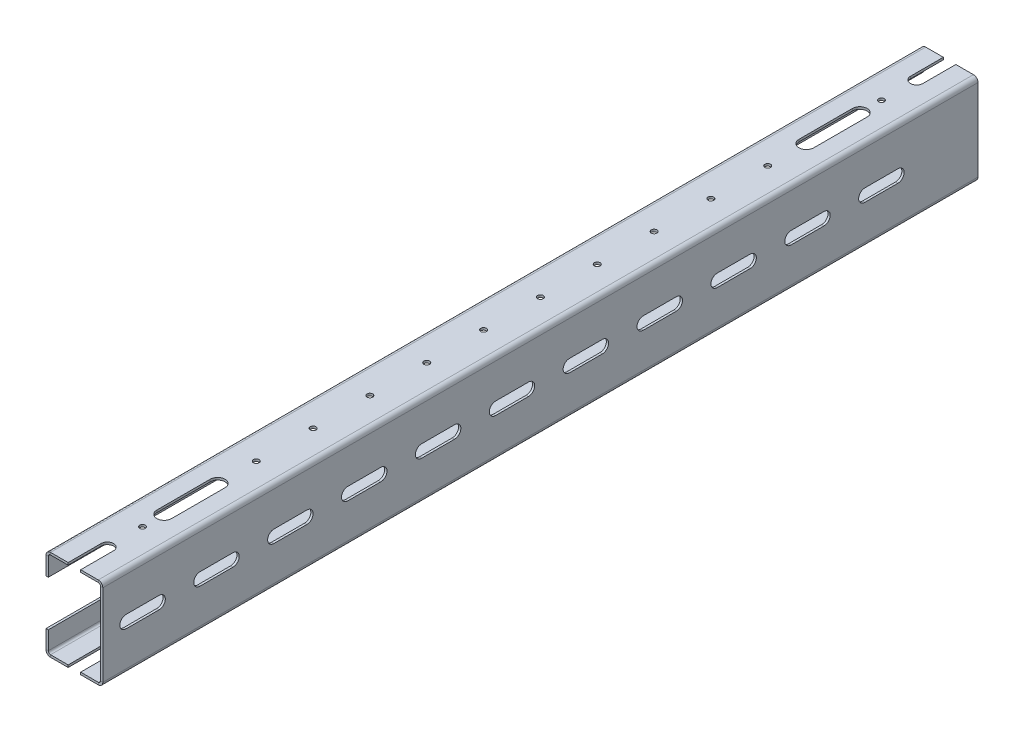
from build123d import *

# Parameters (mm, degrees)
SM_BASE_FLANGE_1_DEPTH = 385
CUT_EXTRUDE_1_DEPTH    = 10
CUT_EXTRUDE_2_DEPTH    = 10
SKETCH_8_R             = 2.5
CUT_EXTRUDE_3_DEPTH    = 10
CUT_EXTRUDE_START      = -10
CUT_EXTRUDE_4_DEPTH    = 10


# Sheet-metal steps are written as plain solids
with BuildPart() as part:
    # Sketch 1 → Базовая кромка1 (new, symmetric)
    with BuildSketch(Plane.XY):
        with BuildLine():
            Line((-50, -20), (-50, -36))
            ThreePointArc((-50, -36), (-48.828427125, -38.828427125), (-46, -40))
            Line((-46, -40), (-4, -40))
            ThreePointArc((-4, -40), (-1.171572875, -38.828427125), (0, -36))
            Line((0, -36), (0, 36))
            ThreePointArc((0, 36), (-1.171572875, 38.828427125), (-4, 40))
            Line((-4, 40), (-46, 40))
            ThreePointArc((-46, 40), (-48.828427125, 38.828427125), (-50, 36))
            Line((-50, 36), (-50, 20))
            Line((-50, 20), (-48, 20))
            Line((-48, 20), (-48, 36))
            ThreePointArc((-48, 36), (-47.414213562, 37.414213562), (-46, 38))
            Line((-46, 38), (-4, 38))
            ThreePointArc((-4, 38), (-2.585786438, 37.414213562), (-2, 36))
            Line((-2, 36), (-2, -36))
            ThreePointArc((-2, -36), (-2.585786438, -37.414213562), (-4, -38))
            Line((-4, -38), (-46, -38))
            ThreePointArc((-46, -38), (-47.414213562, -37.414213562), (-48, -36))
            Line((-48, -36), (-48, -20))
            Line((-48, -20), (-50, -20))
        make_face()
    extrude(amount=SM_BASE_FLANGE_1_DEPTH, both=True)

    # Эскиз6 → Вырез-Вытянуть1 (cut)
    with BuildSketch(Plane(origin=(0, 0, 0), x_dir=(0, 0, -1), z_dir=(1, 0, 0))):
        with BuildLine():
            Line((-364.5, 5.5), (-335.5, 5.5))
            ThreePointArc((-335.5, 5.5), (-330, 0), (-335.5, -5.5))
            Line((-335.5, -5.5), (-364.5, -5.5))
            ThreePointArc((-364.5, -5.5), (-370, 0), (-364.5, 5.5))
        make_face()
        with BuildLine():
            Line((-299.5, 5.5), (-270.5, 5.5))
            ThreePointArc((-270.5, 5.5), (-265, 0), (-270.5, -5.5))
            Line((-270.5, -5.5), (-299.5, -5.5))
            ThreePointArc((-299.5, -5.5), (-305, 0), (-299.5, 5.5))
        make_face()
        with BuildLine():
            Line((-234.5, 5.5), (-205.5, 5.5))
            ThreePointArc((-205.5, 5.5), (-200, 0), (-205.5, -5.5))
            Line((-205.5, -5.5), (-234.5, -5.5))
            ThreePointArc((-234.5, -5.5), (-240, 0), (-234.5, 5.5))
        make_face()
        with BuildLine():
            Line((-169.5, 5.5), (-140.5, 5.5))
            ThreePointArc((-140.5, 5.5), (-135, 0), (-140.5, -5.5))
            Line((-140.5, -5.5), (-169.5, -5.5))
            ThreePointArc((-169.5, -5.5), (-175, 0), (-169.5, 5.5))
        make_face()
        with BuildLine():
            Line((-104.5, 5.5), (-75.5, 5.5))
            ThreePointArc((-75.5, 5.5), (-70, 0), (-75.5, -5.5))
            Line((-75.5, -5.5), (-104.5, -5.5))
            ThreePointArc((-104.5, -5.5), (-110, 0), (-104.5, 5.5))
        make_face()
        with BuildLine():
            Line((-39.5, 5.5), (-10.5, 5.5))
            ThreePointArc((-10.5, 5.5), (-5, 0), (-10.5, -5.5))
            Line((-10.5, -5.5), (-39.5, -5.5))
            ThreePointArc((-39.5, -5.5), (-45, 0), (-39.5, 5.5))
        make_face()
        with BuildLine():
            Line((25.5, 5.5), (54.5, 5.5))
            ThreePointArc((54.5, 5.5), (60, 0), (54.5, -5.5))
            Line((54.5, -5.5), (25.5, -5.5))
            ThreePointArc((25.5, -5.5), (20, 0), (25.5, 5.5))
        make_face()
        with BuildLine():
            Line((90.5, 5.5), (119.5, 5.5))
            ThreePointArc((119.5, 5.5), (125, 0), (119.5, -5.5))
            Line((119.5, -5.5), (90.5, -5.5))
            ThreePointArc((90.5, -5.5), (85, 0), (90.5, 5.5))
        make_face()
        with BuildLine():
            Line((155.5, 5.5), (184.5, 5.5))
            ThreePointArc((184.5, 5.5), (190, 0), (184.5, -5.5))
            Line((184.5, -5.5), (155.5, -5.5))
            ThreePointArc((155.5, -5.5), (150, 0), (155.5, 5.5))
        make_face()
        with BuildLine():
            Line((220.5, 5.5), (249.5, 5.5))
            ThreePointArc((249.5, 5.5), (255, 0), (249.5, -5.5))
            Line((249.5, -5.5), (220.5, -5.5))
            ThreePointArc((220.5, -5.5), (215, 0), (220.5, 5.5))
        make_face()
        with BuildLine():
            Line((285.5, 5.5), (314.5, 5.5))
            ThreePointArc((314.5, 5.5), (320, 0), (314.5, -5.5))
            Line((314.5, -5.5), (285.5, -5.5))
            ThreePointArc((285.5, -5.5), (280, 0), (285.5, 5.5))
        make_face()
    extrude(amount=-CUT_EXTRUDE_1_DEPTH, mode=Mode.SUBTRACT)

    # Эскиз7 → Вырез-Вытянуть2 (cut)
    with BuildSketch(Plane(origin=(0, 40, 0), x_dir=(1, 0, 0), z_dir=(0, 1, 0))):
        with BuildLine():
            Line((-30.5, -385), (-30.5, -356))
            ThreePointArc((-30.5, -356), (-25, -350.5), (-19.5, -356))
            Line((-19.5, -356), (-19.5, -385))
            ThreePointArc((-19.5, -385), (-25, -390.5), (-30.5, -385))
        make_face()
        with BuildLine():
            Line((-31.5, -306), (-31.5, -259))
            ThreePointArc((-31.5, -259), (-25, -252.5), (-18.5, -259))
            Line((-18.5, -259), (-18.5, -306))
            ThreePointArc((-18.5, -306), (-25, -312.5), (-31.5, -306))
        make_face()
        with BuildLine():
            Line((-30.5, 385), (-30.5, 356))
            ThreePointArc((-30.5, 356), (-25, 350.5), (-19.5, 356))
            Line((-19.5, 356), (-19.5, 385))
            ThreePointArc((-19.5, 385), (-25, 390.5), (-30.5, 385))
        make_face()
        with BuildLine():
            Line((-31.5, 306), (-31.5, 259))
            ThreePointArc((-31.5, 259), (-25, 252.5), (-18.5, 259))
            Line((-18.5, 259), (-18.5, 306))
            ThreePointArc((-18.5, 306), (-25, 312.5), (-31.5, 306))
        make_face()
    extrude(amount=-CUT_EXTRUDE_2_DEPTH, mode=Mode.SUBTRACT)

    # Эскиз8 → Вырез-Вытянуть3 (cut)
    with BuildSketch(Plane(origin=(0, 40, 0), x_dir=(1, 0, 0), z_dir=(0, 1, 0))):
        with Locations(Location((-25, -325, 0), (0, 0, 270))):
            Circle(SKETCH_8_R)
        with Locations((-25, -275)):
            Circle(SKETCH_8_R)
        with Locations(Location((-25, -225, 0), (0, 0, 270))):
            Circle(SKETCH_8_R)
        with Locations(Location((-25, -175, 0), (0, 0, 270))):
            Circle(SKETCH_8_R)
        with Locations(Location((-25, -125, 0), (0, 0, 270))):
            Circle(SKETCH_8_R)
        with Locations(Location((-25, -75, 0), (0, 0, 270))):
            Circle(SKETCH_8_R)
        with Locations(Location((-25, -25, 0), (0, 0, 270))):
            Circle(SKETCH_8_R)
        with Locations(Location((-25, 25, 0), (0, 0, 270))):
            Circle(SKETCH_8_R)
        with Locations(Location((-25, 75, 0), (0, 0, 270))):
            Circle(SKETCH_8_R)
        with Locations(Location((-25, 125, 0), (0, 0, 270))):
            Circle(SKETCH_8_R)
        with Locations(Location((-25, 175, 0), (0, 0, 270))):
            Circle(SKETCH_8_R)
        with Locations(Location((-25, 225, 0), (0, 0, 270))):
            Circle(SKETCH_8_R)
        with Locations((-25, 275)):
            Circle(SKETCH_8_R)
        with Locations(Location((-25, 325, 0), (0, 0, 270))):
            Circle(SKETCH_8_R)
    extrude(amount=-CUT_EXTRUDE_3_DEPTH, mode=Mode.SUBTRACT)

    # Эскиз9 → Вырез-Вытянуть4 (cut)
    with BuildSketch(Plane.XZ.offset(40).offset(CUT_EXTRUDE_START)):
        with BuildLine():
            Line((-19.5, 385), (-19.5, 356))
            ThreePointArc((-19.5, 356), (-25, 350.5), (-30.5, 356))
            Line((-30.5, 356), (-30.5, 385))
            ThreePointArc((-30.5, 385), (-25, 390.5), (-19.5, 385))
        make_face()
        with BuildLine():
            Line((-30.5, -385), (-30.5, -356))
            ThreePointArc((-30.5, -356), (-25, -350.5), (-19.5, -356))
            Line((-19.5, -356), (-19.5, -385))
            ThreePointArc((-19.5, -385), (-25, -390.5), (-30.5, -385))
        make_face()
    extrude(amount=CUT_EXTRUDE_4_DEPTH, mode=Mode.SUBTRACT)


solid = part.part
